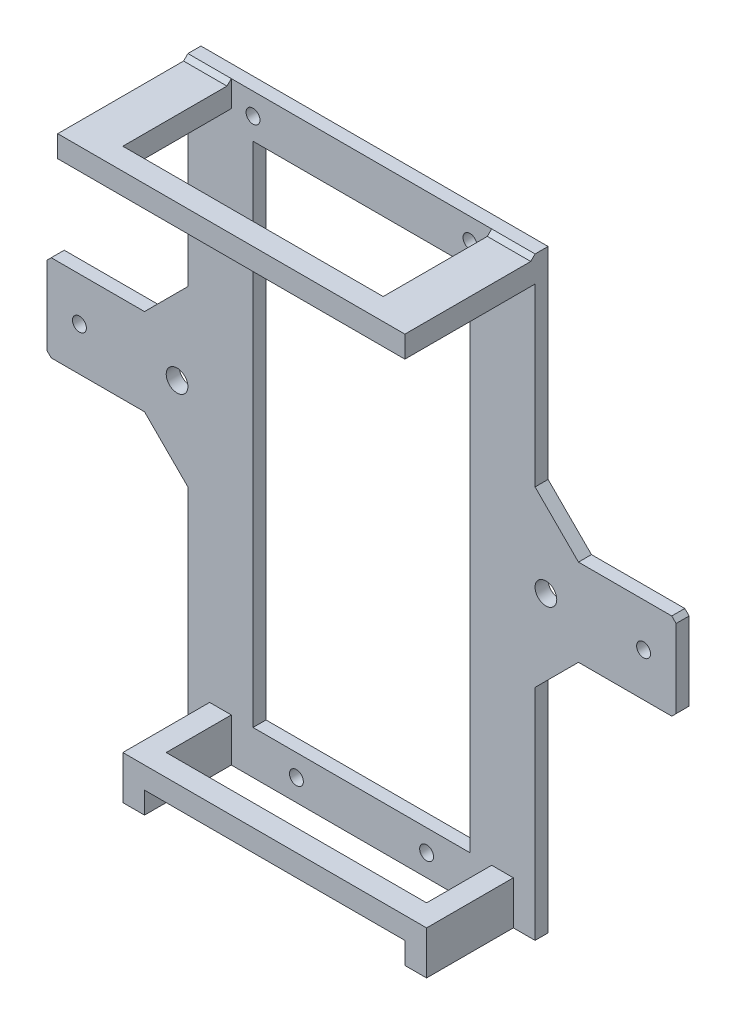
from build123d import *

# Parameters (mm, degrees)
SKETCH_9_R       = 1.6
SKETCH_9_R_2     = 2.5
SKETCH_9_W       = 50
SKETCH_9_H       = 117
EXTRUDE_7_DEPTH  = 3
SKETCH_10_W      = 10
SKETCH_10_H      = 5
EXTRUDE_8_DEPTH  = 30
SKETCH_11_W      = 5
SKETCH_11_H      = 10
EXTRUDE_9_DEPTH  = 20
SKETCH_12_W      = 80
SKETCH_12_H      = 5
EXTRUDE_10_DEPTH = 5
SKETCH_14_W      = 70
SKETCH_14_H      = 5
EXTRUDE_11_DEPTH = 5
CHAMFER_2_SIZE   = 1
CHAMFER_3_SIZE   = 10


with BuildPart() as part:
    # 草图9 → 凸台-拉伸7 (new body)
    with BuildSketch(Plane.XY):
        Polygon((-40, 66.5), (40, 66.5), (40, 10), (72.5, 10), (72.5, -10), (40, -10), (40, -70.5), (-40, -70.5), (-40, -10), (-72.5, -10), (-72.5, 10), (-40, 10), align=None)
        with Locations((25, 61.5)):
            Circle(SKETCH_9_R, mode=Mode.SUBTRACT)
        with Locations((15, -65.5)):
            Circle(SKETCH_9_R, mode=Mode.SUBTRACT)
        with Locations((42.5, 0)):
            Circle(SKETCH_9_R_2, mode=Mode.SUBTRACT)
        with Locations(Location((-42.5, 0, 0), (0, 0, 180))):
            Circle(SKETCH_9_R_2, mode=Mode.SUBTRACT)
        with Locations(Location((-15, -65.5, 0), (0, 0, 180))):
            Circle(SKETCH_9_R, mode=Mode.SUBTRACT)
        with Locations(Location((-25, 61.5, 0), (0, 0, 180))):
            Circle(SKETCH_9_R, mode=Mode.SUBTRACT)
        with Locations((-65, 0)):
            Circle(SKETCH_9_R, mode=Mode.SUBTRACT)
        with Locations((65, 0)):
            Circle(SKETCH_9_R, mode=Mode.SUBTRACT)
        with Locations((0, -2)):
            Rectangle(SKETCH_9_W, SKETCH_9_H, mode=Mode.SUBTRACT)
    extrude(amount=EXTRUDE_7_DEPTH)

    # 草图10 → 凸台-拉伸8 (add)
    with BuildSketch(Plane.XY.offset(3)):
        with Locations((-35, 63)):
            Rectangle(SKETCH_10_W, SKETCH_10_H)
        with Locations((35, 63)):
            Rectangle(SKETCH_10_W, SKETCH_10_H)
    extrude(amount=EXTRUDE_8_DEPTH)

    # 草图11 → 凸台-拉伸9 (add)
    with BuildSketch(Plane.XY.offset(3)):
        with Locations((-32.5, -65.5)):
            Rectangle(SKETCH_11_W, SKETCH_11_H)
        with Locations((32.5, -65.5)):
            Rectangle(SKETCH_11_W, SKETCH_11_H)
    extrude(amount=EXTRUDE_9_DEPTH)

    # 草图12 → 凸台-拉伸10 (add)
    with BuildSketch(Plane.XY.offset(33)):
        with Locations((0, 63)):
            Rectangle(SKETCH_12_W, SKETCH_12_H)
    extrude(amount=-EXTRUDE_10_DEPTH)

    # 草图14 → 凸台-拉伸11 (add)
    with BuildSketch(Plane.XY.offset(23)):
        with Locations((0, -63)):
            Rectangle(SKETCH_14_W, SKETCH_14_H)
    extrude(amount=-EXTRUDE_11_DEPTH)

    # 倒角2
    chamfer_2_edges = [part.edges().sort_by_distance(p)[0] for p in [
        (35, 65.5, 3),
        (-35, 65.5, 3),
        (72.5, -10, 1.5),
        (72.5, 10, 1.5),
        (-72.5, -10, 1.5),
        (-72.5, 10, 1.5),
    ]]
    chamfer(chamfer_2_edges, length=CHAMFER_2_SIZE - 0.0001)  # a hair under: the kernel refuses the full size

    # 倒角3
    chamfer_3_edges = [part.edges().sort_by_distance(p)[0] for p in [
        (40, 10, 1.5),
        (40, -10, 1.5),
        (-40, -10, 1.5),
        (-40, 10, 1.5),
    ]]
    chamfer(chamfer_3_edges, length=CHAMFER_3_SIZE)


solid = part.part
